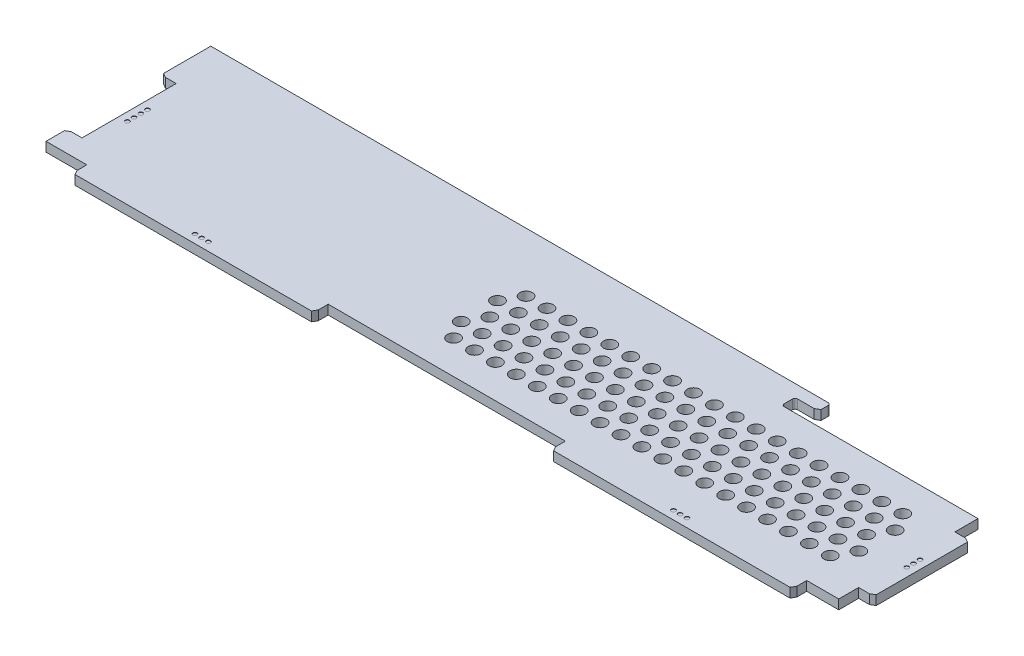
from build123d import *
from OCP.BRepFilletAPI import BRepFilletAPI_MakeChamfer

# Parameters (mm, degrees)
SKETCH1_W               = 245.11
SKETCH1_H               = 50
BOSS_EXTRUDE1_DEPTH     = 2.8575
SKETCH3_W               = 73.236666582
SKETCH3_H               = 4.318
BOSS_EXTRUDE2_DEPTH     = 2.8575
CUT_EXTRUDE1_REACH      = 128.045
SKETCH4_W               = 4.572
SKETCH4_H               = 28.575
SKETCH4_H_2             = 7.0105
SKETCH4_H_3             = 6.0325
CUT_EXTRUDE2_REACH      = 128.045
SKETCH11_R              = 0.635
CUT_EXTRUDE4_DEPTH      = 0.127
FILL_PATTERN1_OUTLINE_R = 1.905
FILL_PATTERN1_DEPTH     = 2.8575
CHAMFER1_SIZE           = 0.762
CHAMFER1_SIZE2          = 1.319822715
CHAMFER2_SIZE           = 0.762
CHAMFER2_SIZE2          = 1.319822715
FILLET1_R               = 0.762


# Read off the part's stored shape, not the designer's step: Fill Pattern1
with BuildPart() as part:
    # Sketch1 → Boss-Extrude1 (new body)
    with BuildSketch(Plane(origin=(0, 0, 0), x_dir=(1, 0, 0), z_dir=(0, 1, 0))):
        Rectangle(SKETCH1_W, SKETCH1_H)
    extrude(amount=BOSS_EXTRUDE1_DEPTH)

    # Sketch3 → Boss-Extrude2 (add)
    with BuildSketch(Plane.XZ):
        with Locations((-73.554166709, 27.159)):
            Rectangle(SKETCH3_W, SKETCH3_H)
        with Locations((71.649166455, 27.159)):
            Rectangle(SKETCH3_W, SKETCH3_H)
    extrude(amount=-BOSS_EXTRUDE2_DEPTH)

    # Sketch4 → Cut-Extrude1 (cut, up to next)
    with BuildSketch(Plane(origin=(0, 2.8575, 0), x_dir=(1, 0, 0), z_dir=(0, 1, 0)), mode=Mode.PRIVATE) as cut_extrude1_sk1:
        with Locations((-120.269, -4.3625)):
            Rectangle(SKETCH4_W, SKETCH4_H)
    cut_extrude1_tool1 = extrude(cut_extrude1_sk1.sketch, amount=-CUT_EXTRUDE1_REACH, mode=Mode.PRIVATE) & part.part
    # Sketch4 → Cut-Extrude1 (cut, up to next)
    with BuildSketch(Plane(origin=(0, 2.8575, 0), x_dir=(1, 0, 0), z_dir=(0, 1, 0)), mode=Mode.PRIVATE) as cut_extrude1_sk2:
        with Locations((120.269, 13.74775)):
            Rectangle(SKETCH4_W, SKETCH4_H_2)
    cut_extrude1_tool2 = extrude(cut_extrude1_sk2.sketch, amount=-CUT_EXTRUDE1_REACH, mode=Mode.PRIVATE) & part.part
    # Sketch4 → Cut-Extrude1 (cut, up to next)
    with BuildSketch(Plane(origin=(0, 2.8575, 0), x_dir=(1, 0, 0), z_dir=(0, 1, 0)), mode=Mode.PRIVATE) as cut_extrude1_sk3:
        with Locations((120.269, -21.98375)):
            Rectangle(SKETCH4_W, SKETCH4_H_3)
    cut_extrude1_tool3 = extrude(cut_extrude1_sk3.sketch, amount=-CUT_EXTRUDE1_REACH, mode=Mode.PRIVATE) & part.part
    add(cut_extrude1_tool1.solids().sort_by_distance((-120.269, 2.8575, 4.3625))[0], mode=Mode.SUBTRACT)
    add(cut_extrude1_tool2.solids().sort_by_distance((120.269, 2.8575, -13.74775))[0], mode=Mode.SUBTRACT)
    add(cut_extrude1_tool3.solids().sort_by_distance((120.269, 2.8575, 21.98375))[0], mode=Mode.SUBTRACT)

    # Sketch5 → Cut-Extrude2 (cut, up to next)
    with BuildSketch(Plane(origin=(0, 2.8575, 0), x_dir=(1, 0, 0), z_dir=(0, 1, 0)), mode=Mode.PRIVATE) as cut_extrude2_sk1:
        Polygon((65.532, 25), (122.555, 25), (122.555, 17.253), (58.42, 17.253), (58.42, 21.317), (65.532, 21.317), align=None)
    cut_extrude2_tool1 = extrude(cut_extrude2_sk1.sketch, amount=-CUT_EXTRUDE2_REACH, mode=Mode.PRIVATE) & part.part
    add(cut_extrude2_tool1.solids().sort_by_distance((92.074241, 2.8575, -21.013414))[0], mode=Mode.SUBTRACT)

    # Sketch11 → Cut-Extrude4 (cut)
    with BuildSketch(Plane(origin=(0, 2.8575, 0), x_dir=(1, 0, 0), z_dir=(0, 1, 0))):
        with Locations(Location((120.015, -2.3305, 0), (0, 0, 270))):
            Circle(SKETCH11_R)
        with Locations(Location((120.015, -4.3625, 0), (0, 0, 270))):
            Circle(SKETCH11_R)
        with Locations(Location((120.015, -6.3945, 0), (0, 0, 270))):
            Circle(SKETCH11_R)
        with Locations(Location((73.681166455, -26.778, 0), (0, 0, 270))):
            Circle(SKETCH11_R)
        with Locations(Location((71.649166455, -26.778, 0), (0, 0, 270))):
            Circle(SKETCH11_R)
        with Locations(Location((69.617166455, -26.778, 0), (0, 0, 270))):
            Circle(SKETCH11_R)
        with Locations(Location((-71.522166709, -26.778, 0), (0, 0, 270))):
            Circle(SKETCH11_R)
        with Locations(Location((-73.554166709, -26.778, 0), (0, 0, 270))):
            Circle(SKETCH11_R)
        with Locations(Location((-75.586166709, -26.778, 0), (0, 0, 270))):
            Circle(SKETCH11_R)
        with Locations(Location((-115.443, -1.3145, 0), (0, 0, 270))):
            Circle(SKETCH11_R)
        with Locations(Location((-115.443, -3.3465, 0), (0, 0, 270))):
            Circle(SKETCH11_R)
        with Locations(Location((-115.443, -5.3785, 0), (0, 0, 270))):
            Circle(SKETCH11_R)
        with Locations(Location((-115.443, -7.4105, 0), (0, 0, 270))):
            Circle(SKETCH11_R)
    extrude(amount=-CUT_EXTRUDE4_DEPTH, mode=Mode.SUBTRACT)

    # Fill Pattern1 outline → Fill Pattern1 (cut)
    with BuildSketch(Plane(origin=(0, 0, 0), x_dir=(1, 0, 0), z_dir=(0, 1, 0))):
        with Locations((-12.192, 1.625761314)):
            Circle(FILL_PATTERN1_OUTLINE_R)
        with Locations((70.358, 1.625761314)):
            Circle(FILL_PATTERN1_OUTLINE_R)
        with Locations((76.708, 1.625761314)):
            Circle(FILL_PATTERN1_OUTLINE_R)
        with Locations((83.058, 1.625761314)):
            Circle(FILL_PATTERN1_OUTLINE_R)
        with Locations((89.408, 1.625761314)):
            Circle(FILL_PATTERN1_OUTLINE_R)
        with Locations((3.683, 7.125022628)):
            Circle(FILL_PATTERN1_OUTLINE_R)
        with Locations((108.458, 1.625761314)):
            Circle(FILL_PATTERN1_OUTLINE_R)
        with Locations((102.108, 1.625761314)):
            Circle(FILL_PATTERN1_OUTLINE_R)
        with Locations((95.758, 1.625761314)):
            Circle(FILL_PATTERN1_OUTLINE_R)
        with Locations((64.008, 1.625761314)):
            Circle(FILL_PATTERN1_OUTLINE_R)
        with Locations((57.658, 1.625761314)):
            Circle(FILL_PATTERN1_OUTLINE_R)
        with Locations((51.308, 1.625761314)):
            Circle(FILL_PATTERN1_OUTLINE_R)
        with Locations((44.958, 1.625761314)):
            Circle(FILL_PATTERN1_OUTLINE_R)
        with Locations((38.608, 1.625761314)):
            Circle(FILL_PATTERN1_OUTLINE_R)
        with Locations((32.258, 1.625761314)):
            Circle(FILL_PATTERN1_OUTLINE_R)
        with Locations((25.908, 1.625761314)):
            Circle(FILL_PATTERN1_OUTLINE_R)
        with Locations((19.558, 1.625761314)):
            Circle(FILL_PATTERN1_OUTLINE_R)
        with Locations((10.033, 7.125022628)):
            Circle(FILL_PATTERN1_OUTLINE_R)
        with Locations((16.383, 7.125022628)):
            Circle(FILL_PATTERN1_OUTLINE_R)
        with Locations((22.733, 7.125022628)):
            Circle(FILL_PATTERN1_OUTLINE_R)
        with Locations((29.083, 7.125022628)):
            Circle(FILL_PATTERN1_OUTLINE_R)
        with Locations((35.433, 7.125022628)):
            Circle(FILL_PATTERN1_OUTLINE_R)
        with Locations((41.783, 7.125022628)):
            Circle(FILL_PATTERN1_OUTLINE_R)
        with Locations((48.133, 7.125022628)):
            Circle(FILL_PATTERN1_OUTLINE_R)
        with Locations((54.483, 7.125022628)):
            Circle(FILL_PATTERN1_OUTLINE_R)
        with Locations((60.833, 7.125022628)):
            Circle(FILL_PATTERN1_OUTLINE_R)
        with Locations((67.183, 7.125022628)):
            Circle(FILL_PATTERN1_OUTLINE_R)
        with Locations((73.533, 7.125022628)):
            Circle(FILL_PATTERN1_OUTLINE_R)
        with Locations((79.883, 7.125022628)):
            Circle(FILL_PATTERN1_OUTLINE_R)
        with Locations((86.233, 7.125022628)):
            Circle(FILL_PATTERN1_OUTLINE_R)
        with Locations((92.583, 7.125022628)):
            Circle(FILL_PATTERN1_OUTLINE_R)
        with Locations((98.933, 7.125022628)):
            Circle(FILL_PATTERN1_OUTLINE_R)
        with Locations((105.283, 7.125022628)):
            Circle(FILL_PATTERN1_OUTLINE_R)
        with Locations((86.233, -14.872022628)):
            Circle(FILL_PATTERN1_OUTLINE_R)
        with Locations((92.583, -14.872022628)):
            Circle(FILL_PATTERN1_OUTLINE_R)
        with Locations((98.933, -14.872022628)):
            Circle(FILL_PATTERN1_OUTLINE_R)
        with Locations((105.283, -14.872022628)):
            Circle(FILL_PATTERN1_OUTLINE_R)
        with Locations((-9.017, 7.125022628)):
            Circle(FILL_PATTERN1_OUTLINE_R)
        with Locations((-9.017, -3.8735)):
            Circle(FILL_PATTERN1_OUTLINE_R)
        with Locations((-5.842, -9.372761314)):
            Circle(FILL_PATTERN1_OUTLINE_R)
        with Locations((0.508, -9.372761314)):
            Circle(FILL_PATTERN1_OUTLINE_R)
        with Locations((6.858, -9.372761314)):
            Circle(FILL_PATTERN1_OUTLINE_R)
        with Locations((13.208, -9.372761314)):
            Circle(FILL_PATTERN1_OUTLINE_R)
        with Locations((19.558, -9.372761314)):
            Circle(FILL_PATTERN1_OUTLINE_R)
        with Locations((25.908, -9.372761314)):
            Circle(FILL_PATTERN1_OUTLINE_R)
        with Locations((32.258, -9.372761314)):
            Circle(FILL_PATTERN1_OUTLINE_R)
        with Locations((38.608, -9.372761314)):
            Circle(FILL_PATTERN1_OUTLINE_R)
        with Locations((44.958, -9.372761314)):
            Circle(FILL_PATTERN1_OUTLINE_R)
        with Locations((51.308, -9.372761314)):
            Circle(FILL_PATTERN1_OUTLINE_R)
        with Locations((79.883, -14.872022628)):
            Circle(FILL_PATTERN1_OUTLINE_R)
        with Locations((73.533, -14.872022628)):
            Circle(FILL_PATTERN1_OUTLINE_R)
        with Locations((67.183, -14.872022628)):
            Circle(FILL_PATTERN1_OUTLINE_R)
        with Locations((60.833, -14.872022628)):
            Circle(FILL_PATTERN1_OUTLINE_R)
        with Locations((54.483, -14.872022628)):
            Circle(FILL_PATTERN1_OUTLINE_R)
        with Locations((48.133, -14.872022628)):
            Circle(FILL_PATTERN1_OUTLINE_R)
        with Locations((41.783, -14.872022628)):
            Circle(FILL_PATTERN1_OUTLINE_R)
        with Locations((35.433, -14.872022628)):
            Circle(FILL_PATTERN1_OUTLINE_R)
        with Locations((29.083, -14.872022628)):
            Circle(FILL_PATTERN1_OUTLINE_R)
        with Locations((22.733, -14.872022628)):
            Circle(FILL_PATTERN1_OUTLINE_R)
        with Locations((16.383, -14.872022628)):
            Circle(FILL_PATTERN1_OUTLINE_R)
        with Locations((10.033, -14.872022628)):
            Circle(FILL_PATTERN1_OUTLINE_R)
        with Locations((3.683, -14.872022628)):
            Circle(FILL_PATTERN1_OUTLINE_R)
        with Locations((-2.667, -14.872022628)):
            Circle(FILL_PATTERN1_OUTLINE_R)
        with Locations((-9.017, -14.872022628)):
            Circle(FILL_PATTERN1_OUTLINE_R)
        with Locations((-12.192, -9.372761314)):
            Circle(FILL_PATTERN1_OUTLINE_R)
        with Locations((35.433, -3.8735)):
            Circle(FILL_PATTERN1_OUTLINE_R)
        with Locations((41.783, -3.8735)):
            Circle(FILL_PATTERN1_OUTLINE_R)
        with Locations((48.133, -3.8735)):
            Circle(FILL_PATTERN1_OUTLINE_R)
        with Locations((54.483, -3.8735)):
            Circle(FILL_PATTERN1_OUTLINE_R)
        with Locations((60.833, -3.8735)):
            Circle(FILL_PATTERN1_OUTLINE_R)
        with Locations((67.183, -3.8735)):
            Circle(FILL_PATTERN1_OUTLINE_R)
        with Locations((73.533, -3.8735)):
            Circle(FILL_PATTERN1_OUTLINE_R)
        with Locations((79.883, -3.8735)):
            Circle(FILL_PATTERN1_OUTLINE_R)
        with Locations((86.233, -3.8735)):
            Circle(FILL_PATTERN1_OUTLINE_R)
        with Locations((92.583, -3.8735)):
            Circle(FILL_PATTERN1_OUTLINE_R)
        with Locations((98.933, -3.8735)):
            Circle(FILL_PATTERN1_OUTLINE_R)
        with Locations((105.283, -3.8735)):
            Circle(FILL_PATTERN1_OUTLINE_R)
        with Locations((-2.667, 7.125022628)):
            Circle(FILL_PATTERN1_OUTLINE_R)
        with Locations((0.508, 1.625761314)):
            Circle(FILL_PATTERN1_OUTLINE_R)
        with Locations((6.858, 1.625761314)):
            Circle(FILL_PATTERN1_OUTLINE_R)
        with Locations((13.208, 1.625761314)):
            Circle(FILL_PATTERN1_OUTLINE_R)
        with Locations((57.658, -9.372761314)):
            Circle(FILL_PATTERN1_OUTLINE_R)
        with Locations((64.008, -9.372761314)):
            Circle(FILL_PATTERN1_OUTLINE_R)
        with Locations((70.358, -9.372761314)):
            Circle(FILL_PATTERN1_OUTLINE_R)
        with Locations((76.708, -9.372761314)):
            Circle(FILL_PATTERN1_OUTLINE_R)
        with Locations((83.058, -9.372761314)):
            Circle(FILL_PATTERN1_OUTLINE_R)
        with Locations((89.408, -9.372761314)):
            Circle(FILL_PATTERN1_OUTLINE_R)
        with Locations((95.758, -9.372761314)):
            Circle(FILL_PATTERN1_OUTLINE_R)
        with Locations((102.108, -9.372761314)):
            Circle(FILL_PATTERN1_OUTLINE_R)
        with Locations((29.083, -3.8735)):
            Circle(FILL_PATTERN1_OUTLINE_R)
        with Locations((22.733, -3.8735)):
            Circle(FILL_PATTERN1_OUTLINE_R)
        with Locations((16.383, -3.8735)):
            Circle(FILL_PATTERN1_OUTLINE_R)
        with Locations((10.033, -3.8735)):
            Circle(FILL_PATTERN1_OUTLINE_R)
        with Locations((108.458, -9.372761314)):
            Circle(FILL_PATTERN1_OUTLINE_R)
        with Locations((-5.842, 1.625761314)):
            Circle(FILL_PATTERN1_OUTLINE_R)
        with Locations((-2.667, -3.8735)):
            Circle(FILL_PATTERN1_OUTLINE_R)
        with Locations((3.683, -3.8735)):
            Circle(FILL_PATTERN1_OUTLINE_R)
    extrude(amount=FILL_PATTERN1_DEPTH, mode=Mode.SUBTRACT)

    # Chamfer1: one chamfer whose edges measure the first distance from different faces: ONE call of the kernel's chamfer builder (chamfer() names one face for all edges)
    chamfer1_edges_1 = [part.edges().sort_by_distance(p)[0] for p in [
        (-110.1725, 1.42875, 29.318),
    ]]
    chamfer1_side_1 = [part.faces().sort_by_distance(p)[0] for p in [
        (-73.554166709, 1.42875, 29.318),
    ]]
    chamfer1_edges_2 = [part.edges().sort_by_distance(p)[0] for p in [
        (35.030833164, 1.42875, 29.318),
    ]]
    chamfer1_side_2 = [part.faces().sort_by_distance(p)[0] for p in [
        (71.649166455, 1.42875, 29.318),
    ]]
    chamfer1_edges_3 = [part.edges().sort_by_distance(p)[0] for p in [
        (-122.555, 1.42875, -9.925),
    ]]
    chamfer1_side_3 = [part.faces().sort_by_distance(p)[0] for p in [
        (-122.555, 1.42875, -17.4625),
    ]]
    chamfer1_edges_4 = [part.edges().sort_by_distance(p)[0] for p in [
        (122.555, 1.42875, -10.2425),
    ]]
    chamfer1_side_4 = [part.faces().sort_by_distance(p)[0] for p in [
        (122.555, 1.42875, 4.3625),
    ]]
    chamfer1 = BRepFilletAPI_MakeChamfer(part.part.solid().wrapped)
    for e in chamfer1_edges_1:
        chamfer1.Add(CHAMFER1_SIZE, CHAMFER1_SIZE2, e.wrapped, chamfer1_side_1[0].wrapped)  # the first distance lies on this face
    for e in chamfer1_edges_2:
        chamfer1.Add(CHAMFER1_SIZE, CHAMFER1_SIZE2, e.wrapped, chamfer1_side_2[0].wrapped)  # the first distance lies on this face
    for e in chamfer1_edges_3:
        chamfer1.Add(CHAMFER1_SIZE, CHAMFER1_SIZE2, e.wrapped, chamfer1_side_3[0].wrapped)  # the first distance lies on this face
    for e in chamfer1_edges_4:
        chamfer1.Add(CHAMFER1_SIZE, CHAMFER1_SIZE2, e.wrapped, chamfer1_side_4[0].wrapped)  # the first distance lies on this face
    add(Compound.cast(chamfer1.Shape()), mode=Mode.REPLACE)

    # Chamfer2: one chamfer whose edges measure the first distance from different faces: ONE call of the kernel's chamfer builder (chamfer() names one face for all edges)
    chamfer2_edges_1 = [part.edges().sort_by_distance(p)[0] for p in [
        (-36.935833418, 1.42875, 29.318),
    ]]
    chamfer2_side_1 = [part.faces().sort_by_distance(p)[0] for p in [
        (-73.173166709, 1.42875, 29.318),
    ]]
    chamfer2_edges_2 = [part.edges().sort_by_distance(p)[0] for p in [
        (108.267499746, 1.42875, 29.318),
    ]]
    chamfer2_side_2 = [part.faces().sort_by_distance(p)[0] for p in [
        (72.030166455, 1.42875, 29.318),
    ]]
    chamfer2_edges_3 = [part.edges().sort_by_distance(p)[0] for p in [
        (-122.555, 1.42875, 18.65),
    ]]
    chamfer2_side_3 = [part.faces().sort_by_distance(p)[0] for p in [
        (-122.555, 1.42875, 21.825),
    ]]
    chamfer2_edges_4 = [part.edges().sort_by_distance(p)[0] for p in [
        (122.555, 1.42875, 18.9675),
    ]]
    chamfer2_side_4 = [part.faces().sort_by_distance(p)[0] for p in [
        (122.555, 1.42875, 4.7435),
    ]]
    chamfer2_edges_5 = [part.edges().sort_by_distance(p)[0] for p in [
        (65.532, 1.42875, -21.317),
    ]]
    chamfer2_side_5 = [part.faces().sort_by_distance(p)[0] for p in [
        (65.532, 1.42875, -23.1585),
    ]]
    chamfer2 = BRepFilletAPI_MakeChamfer(part.part.solid().wrapped)
    for e in chamfer2_edges_1:
        chamfer2.Add(CHAMFER2_SIZE, CHAMFER2_SIZE2, e.wrapped, chamfer2_side_1[0].wrapped)  # the first distance lies on this face
    for e in chamfer2_edges_2:
        chamfer2.Add(CHAMFER2_SIZE, CHAMFER2_SIZE2, e.wrapped, chamfer2_side_2[0].wrapped)  # the first distance lies on this face
    for e in chamfer2_edges_3:
        chamfer2.Add(CHAMFER2_SIZE, CHAMFER2_SIZE2, e.wrapped, chamfer2_side_3[0].wrapped)  # the first distance lies on this face
    for e in chamfer2_edges_4:
        chamfer2.Add(CHAMFER2_SIZE, CHAMFER2_SIZE2, e.wrapped, chamfer2_side_4[0].wrapped)  # the first distance lies on this face
    for e in chamfer2_edges_5:
        chamfer2.Add(CHAMFER2_SIZE, CHAMFER2_SIZE2, e.wrapped, chamfer2_side_5[0].wrapped)  # the first distance lies on this face
    add(Compound.cast(chamfer2.Shape()), mode=Mode.REPLACE)

    # Fillet1
    fillet1_edges = [part.edges().sort_by_distance(p)[0] for p in [
        (58.42, 1.42875, -17.253),
        (58.42, 1.42875, -21.317),
        (65.532, 1.42875, -25),
    ]]
    fillet(fillet1_edges, radius=FILLET1_R)


solid = part.part
